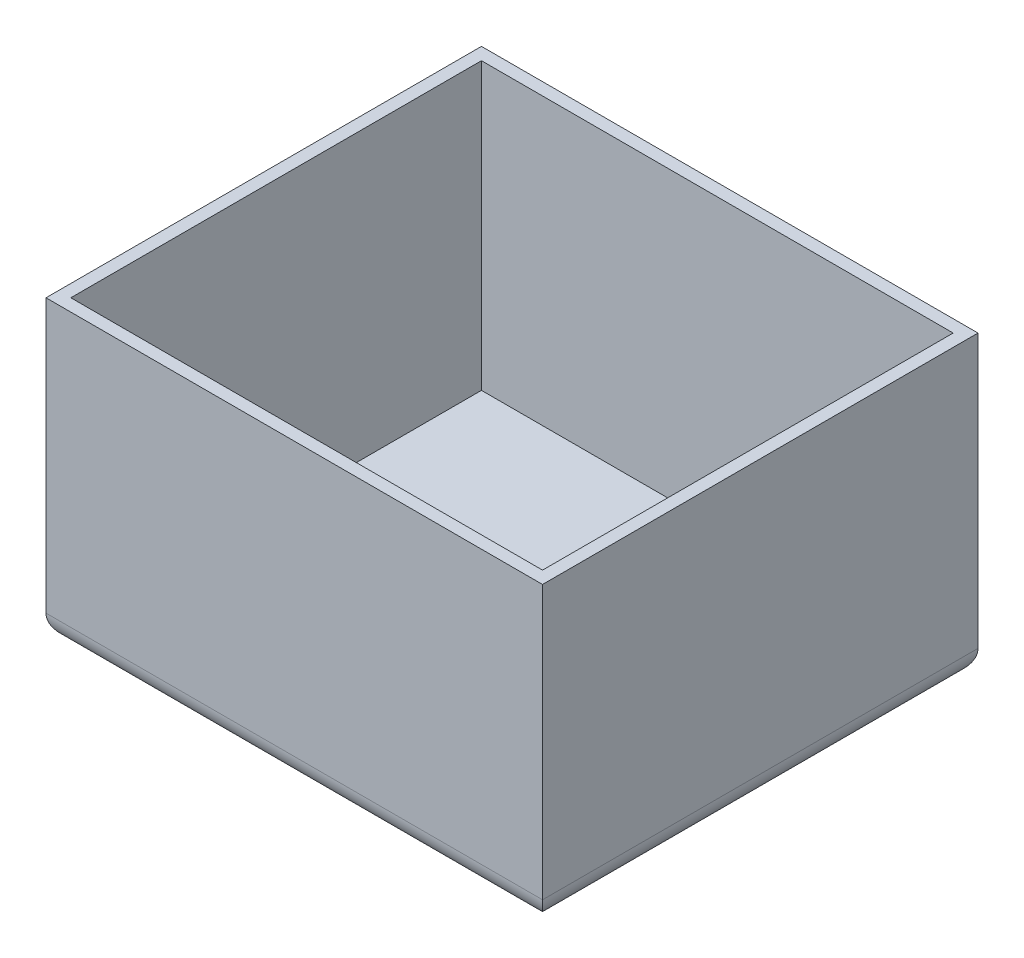
from build123d import *
from build123d.topology import SkipClean

# Parameters (mm, degrees)
SKETCH2_W           = 200
SKETCH2_H           = 120
BOSS_EXTRUDE1_DEPTH = 175.4
SHELL1_T            = -5
SKETCH3_W           = 65.878137889
SKETCH3_H           = 11.111975066
BOSS_EXTRUDE2_DEPTH = 25
SKETCH4_W           = 57.75701827
SKETCH4_H           = 16.361203127
CUT_EXTRUDE1_DEPTH  = 13
FILLET1_START       = 82.402628098
FILLET1_DEPTH       = 11.111975066
FILLET1_START_2     = -1
FILLET1_2_DEPTH     = 202
FILLET1_START_3     = 56.664074803
FILLET1_3_DEPTH     = 85.878137889
FILLET1_START_4     = 58.185895168
FILLET1_4_DEPTH     = 12.639911303
FILLET1_START_5     = 128.582824741
FILLET1_5_DEPTH     = 12.437567587
FILLET1_6_DEPTH     = 177


with BuildPart() as part:
    # Sketch2 → Boss-Extrude1 (new body)
    with BuildSketch(Plane.XY):
        with Locations((100, 60)):
            Rectangle(SKETCH2_W, SKETCH2_H)
    extrude(amount=BOSS_EXTRUDE1_DEPTH)

    # Shell1
    shell1_openings = [part.faces().sort_by_distance(p)[0] for p in [
        (100, 120, 87.7),
    ]]
    offset(amount=SHELL1_T, openings=shell1_openings, kind=Kind.INTERSECTION)

    # Sketch3 → Boss-Extrude2 (add)
    with BuildSketch(Plane.XZ):
        with Locations((99.603143748, 87.958615631)):
            Rectangle(SKETCH3_W, SKETCH3_H)
    extrude(amount=BOSS_EXTRUDE2_DEPTH)

    # Sketch4 → Cut-Extrude1 (cut)
    with BuildSketch(Plane.XY.offset(93.514603164)):
        with Locations((99.704315606, -11.896153919)):
            Rectangle(SKETCH4_W, SKETCH4_H)
    extrude(amount=-CUT_EXTRUDE1_DEPTH, mode=Mode.SUBTRACT)

    # Fillet1: read off the stored shape, not the designer's step
    # Fillet1 outline → Fillet1 (add)
    with BuildSketch(Plane.XY.offset(FILLET1_START)):
        with BuildLine():
            Line((142.542212692, 0), (132.542212692, 0))
            Line((132.542212692, 0), (132.542212692, -10))
            ThreePointArc((132.542212692, -10), (135.47114488, -2.928932188), (142.542212692, 0))
        make_face()
        with BuildLine():
            ThreePointArc((56.664074803, 0), (63.735142615, -2.928932188), (66.664074803, -10))
            Line((66.664074803, -10), (66.664074803, 0))
            Line((66.664074803, 0), (56.664074803, 0))
        make_face()
    extrude(amount=FILLET1_DEPTH)

    # Fillet1 2 outline → Fillet1 2 (cut)
    with BuildSketch(Plane.YZ.offset(FILLET1_START_2)):
        with BuildLine():
            Line((0, 175.4), (0, 165.4))
            ThreePointArc((0, 165.4), (2.928932188, 172.471067812), (10, 175.4))
            Line((10, 175.4), (0, 175.4))
        make_face()
        with BuildLine():
            ThreePointArc((10, 0), (2.928932188, 2.928932188), (0, 10))
            Line((0, 10), (0, 0))
            Line((0, 0), (10, 0))
        make_face()
    extrude(amount=FILLET1_2_DEPTH, mode=Mode.SUBTRACT)

    # Fillet1 3 outline → Fillet1 3 (add)
    with BuildSketch(Plane.YZ.offset(FILLET1_START_3)):
        with BuildLine():
            Line((-3.715552355, 82.402628098), (-3.715552355, 80.181170236))
            ThreePointArc((-3.715552355, 80.181170236), (-0.976572811, 76.712820875), (0, 72.402628098))
            Line((0, 72.402628098), (0, 82.402628098))
            Line((0, 82.402628098), (-3.715552355, 82.402628098))
        make_face()
        with BuildLine():
            Line((-3.715552355, 95.736061025), (-3.715552355, 93.514603164))
            Line((-3.715552355, 93.514603164), (0, 93.514603164))
            Line((0, 93.514603164), (0, 103.514603164))
            ThreePointArc((0, 103.514603164), (-0.976572812, 99.204410387), (-3.715552355, 95.736061025))
        make_face()
    extrude(amount=FILLET1_3_DEPTH)

    # Fillet1 4 outline → Fillet1 4 (add)
    with BuildSketch(Plane.YZ.offset(FILLET1_START_4)):
        with BuildLine():
            ThreePointArc((-10, 82.402628098), (-6.667239986, 81.830921193), (-3.715552355, 80.181170236))
            Line((-3.715552355, 80.181170236), (-3.715552355, 82.402628098))
            Line((-3.715552355, 82.402628098), (-10, 82.402628098))
        make_face()
        with BuildLine():
            Line((-10, 93.514603164), (-3.715552355, 93.514603164))
            Line((-3.715552355, 93.514603164), (-3.715552355, 95.736061025))
            ThreePointArc((-3.715552355, 95.736061025), (-6.667239987, 94.086310068), (-10, 93.514603164))
        make_face()
    extrude(amount=FILLET1_4_DEPTH)

    # Fillet1 5 outline → Fillet1 5 (add)
    with BuildSketch(Plane.YZ.offset(FILLET1_START_5)):
        with BuildLine():
            ThreePointArc((-10, 82.402628098), (-6.667239986, 81.830921193), (-3.715552355, 80.181170236))
            Line((-3.715552355, 80.181170236), (-3.715552355, 82.402628098))
            Line((-3.715552355, 82.402628098), (-10, 82.402628098))
        make_face()
        with BuildLine():
            Line((-10, 93.514603164), (-3.715552355, 93.514603164))
            Line((-3.715552355, 93.514603164), (-3.715552355, 95.736061025))
            ThreePointArc((-3.715552355, 95.736061025), (-6.667239987, 94.086310068), (-10, 93.514603164))
        make_face()
    extrude(amount=FILLET1_5_DEPTH)

    # Fillet1 6 outline → Fillet1 6 (cut)
    with SkipClean():  # the faces are left unmerged after this step: merging them gives an invalid solid
        with BuildSketch(Plane.XY.offset(FILLET1_START_2)):
            with BuildLine():
                Line((200, 12), (200, 10))
                ThreePointArc((200, 10), (197.071067812, 2.928932188), (190, 0))
                Line((190, 0), (142.542212692, 0))
                ThreePointArc((142.542212692, 0), (135.47114488, -2.928932188), (132.542212692, -10))
                Line((132.542212692, -10), (132.542212692, -11))
                Line((132.542212692, -11), (201, -11))
                Line((201, -11), (201, 12))
                Line((201, 12), (200, 12))
            make_face()
            with BuildLine():
                Line((0, 10), (0, 12))
                Line((0, 12), (-1, 12))
                Line((-1, 12), (-1, -11))
                Line((-1, -11), (66.664074803, -11))
                Line((66.664074803, -11), (66.664074803, -10))
                ThreePointArc((66.664074803, -10), (63.735142615, -2.928932188), (56.664074803, 0))
                Line((56.664074803, 0), (10, 0))
                ThreePointArc((10, 0), (2.928932188, 2.928932188), (0, 10))
            make_face()
        extrude(amount=FILLET1_6_DEPTH, mode=Mode.SUBTRACT)


solid = part.part
